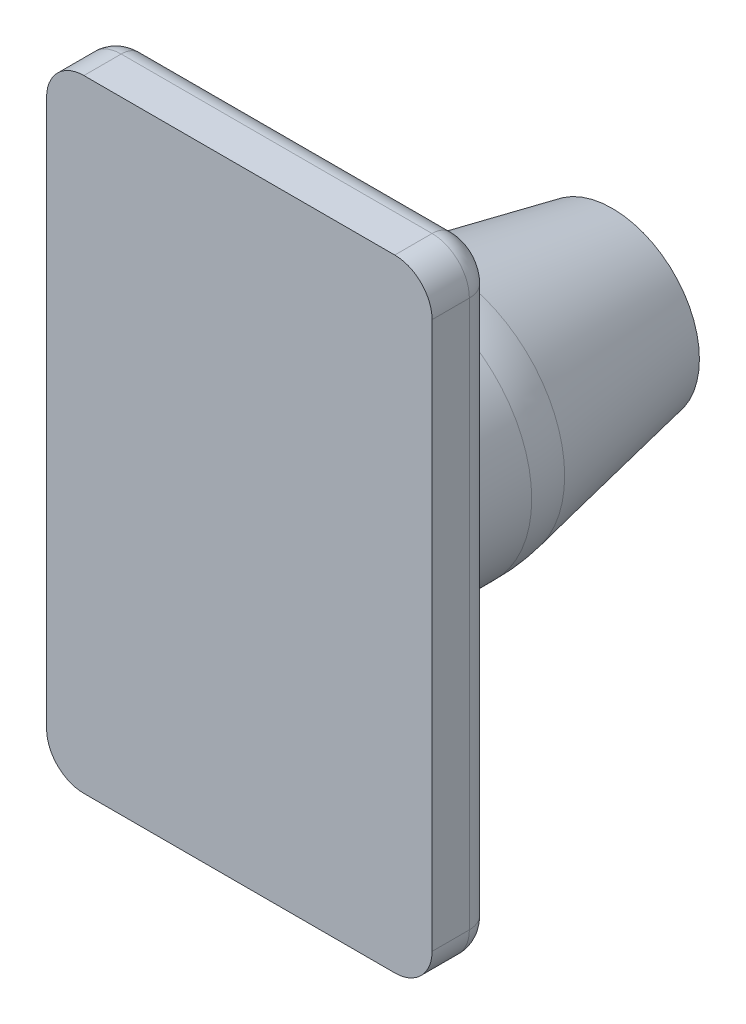
from build123d import *

# Parameters (mm, degrees)
SKETCH1_W           = 31
SKETCH1_H           = 50
BOSS_EXTRUDE1_DEPTH = 5
FILLET1_R           = 3
SKETCH3_R           = 10
SKETCH3_R_2         = 6.55
BOSS_EXTRUDE2_DEPTH = 25
CHAMFER2_SIZE       = 15
CHAMFER2_SIZE2      = 3
FILLET2_R           = 15
FILLET3_R           = 2


with BuildPart() as part:
    # Sketch1 → Boss-Extrude1 (new body)
    with BuildSketch(Plane.XY):
        with Locations((-80, -58)):
            Rectangle(SKETCH1_W, SKETCH1_H)
    extrude(amount=BOSS_EXTRUDE1_DEPTH)

    # Fillet1
    fillet1_edges = [part.edges().sort_by_distance(p)[0] for p in [
        (-64.5, -83, 2.5),
        (-64.5, -33, 2.5),
        (-95.5, -83, 2.5),
        (-95.5, -33, 2.5),
    ]]
    fillet(fillet1_edges, radius=FILLET1_R)

    # Sketch3 → Boss-Extrude2 (add)
    with BuildSketch(Plane(origin=(0, 0, 0), x_dir=(-1, 0, 0), z_dir=(0, 0, -1))):
        with Locations((80, -58)):
            Circle(SKETCH3_R)
        with Locations((80, -58)):
            Circle(SKETCH3_R_2, mode=Mode.SUBTRACT)
    extrude(amount=BOSS_EXTRUDE2_DEPTH)

    # Chamfer2
    chamfer2_edges = [part.edges().sort_by_distance(p)[0] for p in [
        (-70, -58, -25),
    ]]
    chamfer2_side = [part.faces().sort_by_distance(p)[0] for p in [
        (-70, -58, -12.5),
    ]]
    chamfer(chamfer2_edges, length=CHAMFER2_SIZE, length2=CHAMFER2_SIZE2, reference=chamfer2_side[0])

    # Fillet2
    fillet2_edges = [part.edges().sort_by_distance(p)[0] for p in [
        (-70, -58, -10),
    ]]
    fillet(fillet2_edges, radius=FILLET2_R)

    # Fillet3
    fillet3_edges = [part.edges().sort_by_distance(p)[0] for p in [
        (-94.621320344, -33.878679656, 0),
        (-80, -33, 0),
        (-65.378679656, -33.878679656, 0),
        (-64.5, -58, 0),
        (-65.378679656, -82.121320344, 0),
        (-80, -83, 0),
        (-94.621320344, -82.121320344, 0),
        (-95.5, -58, 0),
    ]]
    fillet(fillet3_edges, radius=FILLET3_R)


solid = part.part
